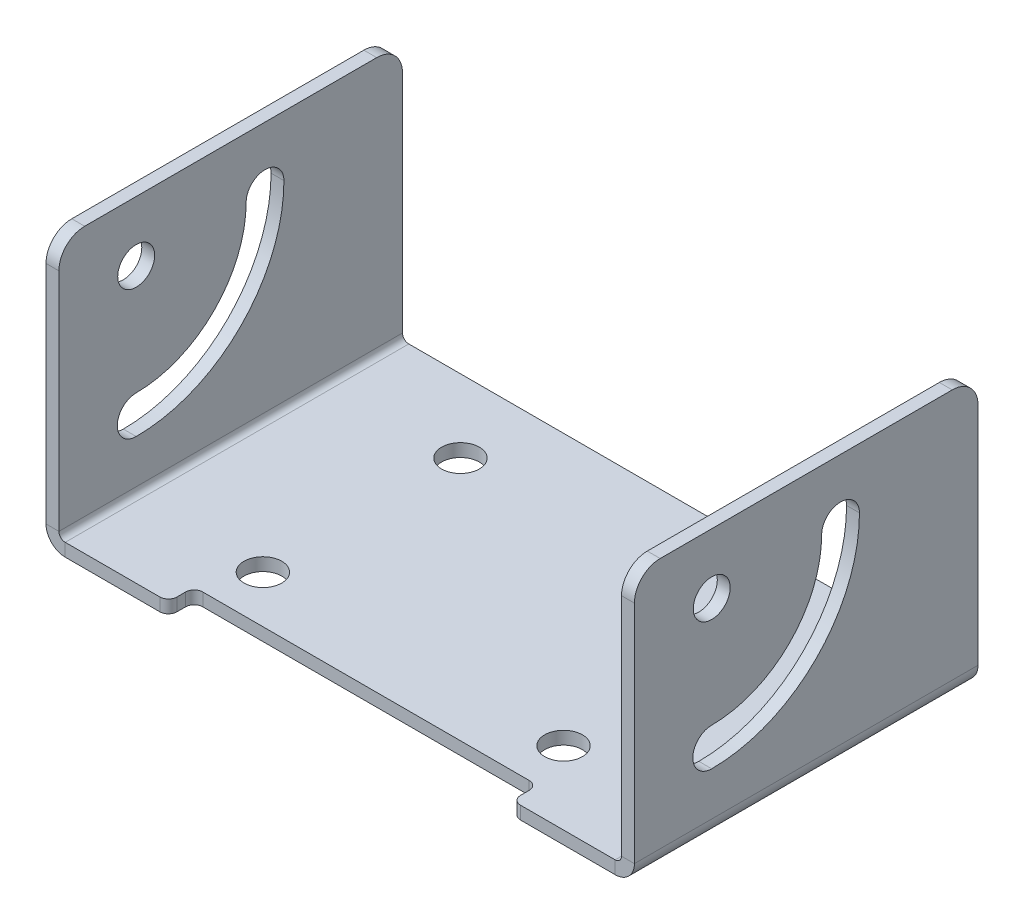
from build123d import *

# Parameters (mm, degrees)
SKETCH_1_W                         = 65.5
SKETCH_1_H                         = 40
SKETCH_1_R                         = 2.2
SM_BASE_FLANGE_1_DEPTH             = 1.5
SM_EDGE_FLANGE_1_STRIP_W           = 7.4732
SM_EDGE_FLANGE_1_STRIP_H           = 1.5
SM_EDGE_FLANGE_1_STRIP_CUT_DEPTH   = 40
SM_EDGE_FLANGE_1_STRIP_2_W         = 7.4732
SM_EDGE_FLANGE_1_STRIP_2_H         = 1.5
SM_EDGE_FLANGE_1_STRIP_CUT_2_DEPTH = 40
SM_EDGE_FLANGE_1_DEPTH             = 40
SM_EDGE_FLANGE_1_BEND_DEPTH        = 40
SKETCH_12_R                        = 2.15
CUT_EXTRUDE_1_DEPTH                = 78.409624725
SKETCH_13_W                        = 40
SKETCH_13_H                        = 3
CUT_EXTRUDE_2_DEPTH                = 50.729895435
FILLET_1_R                         = 1
FILLET_2_R                         = 3


# Sheet-metal steps are written as plain solids
with BuildPart() as part:
    # Sketch 1 → 基体-法兰1 (new body)
    with BuildSketch(Plane(origin=(0, 0, 0), x_dir=(1, 0, 0), z_dir=(0, 1, 0))):
        Rectangle(SKETCH_1_W, SKETCH_1_H)
        with Locations(Location((-17.5, 11.5, 0), (0, 0, 270))):
            Circle(SKETCH_1_R, mode=Mode.SUBTRACT)
        with Locations(Location((17.5, 11.5, 0), (0, 0, 270))):
            Circle(SKETCH_1_R, mode=Mode.SUBTRACT)
        with Locations(Location((17.5, -11.5, 0), (0, 0, 270))):
            Circle(SKETCH_1_R, mode=Mode.SUBTRACT)
        with Locations(Location((-17.5, -11.5, 0), (0, 0, 270))):
            Circle(SKETCH_1_R, mode=Mode.SUBTRACT)
    extrude(amount=-SM_BASE_FLANGE_1_DEPTH)

    # 边线-法兰1 strip (across the edge) → 边线-法兰1 strip cut (cut)
    with BuildSketch(Plane(origin=(-32.75, 0, -20), x_dir=(1, 0, 0), z_dir=(0, 0, 1))):
        with Locations((-3, -0.75)):
            Rectangle(SM_EDGE_FLANGE_1_STRIP_W, SM_EDGE_FLANGE_1_STRIP_H)
    extrude(amount=SM_EDGE_FLANGE_1_STRIP_CUT_DEPTH, mode=Mode.SUBTRACT)

    # 边线-法兰1 strip 2 (across the edge) → 边线-法兰1 strip cut 2 (cut)
    with BuildSketch(Plane(origin=(32.75, 0, 20), x_dir=(-1, 0, 0), z_dir=(0, 0, -1))):
        with Locations((-3, -0.75)):
            Rectangle(SM_EDGE_FLANGE_1_STRIP_2_W, SM_EDGE_FLANGE_1_STRIP_2_H)
    extrude(amount=SM_EDGE_FLANGE_1_STRIP_CUT_2_DEPTH, mode=Mode.SUBTRACT)

    # 边线-法兰1 section (across the edge) → 边线-法兰1 (add)
    with BuildSketch(Plane(origin=(-32.75, 0, -20), x_dir=(1, 0, 0), z_dir=(0, 0, 1))):
        with BuildLine():
            Line((-1.5, 0.7366), (-1.5, 30))
            Line((-1.5, 30), (0, 30))
            Line((0, 30), (0, 0.7366))
            ThreePointArc((0, 0.7366), (0.215745145, 0.215745145), (0.7366, 0))
            Line((0.7366, 0), (0.7366, -1.5))
            ThreePointArc((0.7366, -1.5), (-0.844915027, -0.844915027), (-1.5, 0.7366))
        make_face()
    extrude(amount=SM_EDGE_FLANGE_1_DEPTH)

    # 边线-法兰1 section 2 (across the edge) → 边线-法兰1 bend (add)
    with BuildSketch(Plane(origin=(32.75, 0, 20), x_dir=(-1, 0, 0), z_dir=(0, 0, -1))):
        with BuildLine():
            Line((-1.5, 0.7366), (-1.5, 30))
            Line((-1.5, 30), (0, 30))
            Line((0, 30), (0, 0.7366))
            ThreePointArc((0, 0.7366), (0.215745145, 0.215745145), (0.7366, 0))
            Line((0.7366, 0), (0.7366, -1.5))
            ThreePointArc((0.7366, -1.5), (-0.844915027, -0.844915027), (-1.5, 0.7366))
        make_face()
    extrude(amount=SM_EDGE_FLANGE_1_BEND_DEPTH)

    # 草图12 → 切除-拉伸1 (cut, through all)
    with BuildSketch(Plane.ZY.offset(34.25)):
        with Locations(Location((11, 23, 0), (0, 0, 270))):
            Circle(SKETCH_12_R)
        with BuildLine():
            ThreePointArc((-6.2, 23), (-1.162236636, 10.837763364), (11, 5.8))
            ThreePointArc((11, 5.8), (13.2, 8), (11, 10.2))
            ThreePointArc((11, 10.2), (1.949033201, 13.949033201), (-1.8, 23))
            ThreePointArc((-1.8, 23), (-4, 25.2), (-6.2, 23))
        make_face()
    extrude(amount=-CUT_EXTRUDE_1_DEPTH, mode=Mode.SUBTRACT)

    # 草图13 → 切除-拉伸2 (cut, through all)
    with BuildSketch(Plane(origin=(0, 0, 0), x_dir=(1, 0, 0), z_dir=(0, 1, 0))):
        with Locations((0, -18.5)):
            Rectangle(SKETCH_13_W, SKETCH_13_H)
    extrude(amount=-CUT_EXTRUDE_2_DEPTH, mode=Mode.SUBTRACT)

    # 圆角1
    fillet_1_edges = [part.edges().sort_by_distance(p)[0] for p in [
        (-20, -0.75, 20),
        (-20, -0.75, 17),
        (20, -0.75, 17),
        (20, -0.75, 20),
    ]]
    fillet(fillet_1_edges, radius=FILLET_1_R)

    # 圆角2
    fillet_2_edges = [part.edges().sort_by_distance(p)[0] for p in [
        (-33.5, 30, -20),
        (-33.5, 30, 20),
        (33.5, 30, 20),
        (33.5, 30, -20),
    ]]
    fillet(fillet_2_edges, radius=FILLET_2_R)


solid = part.part
